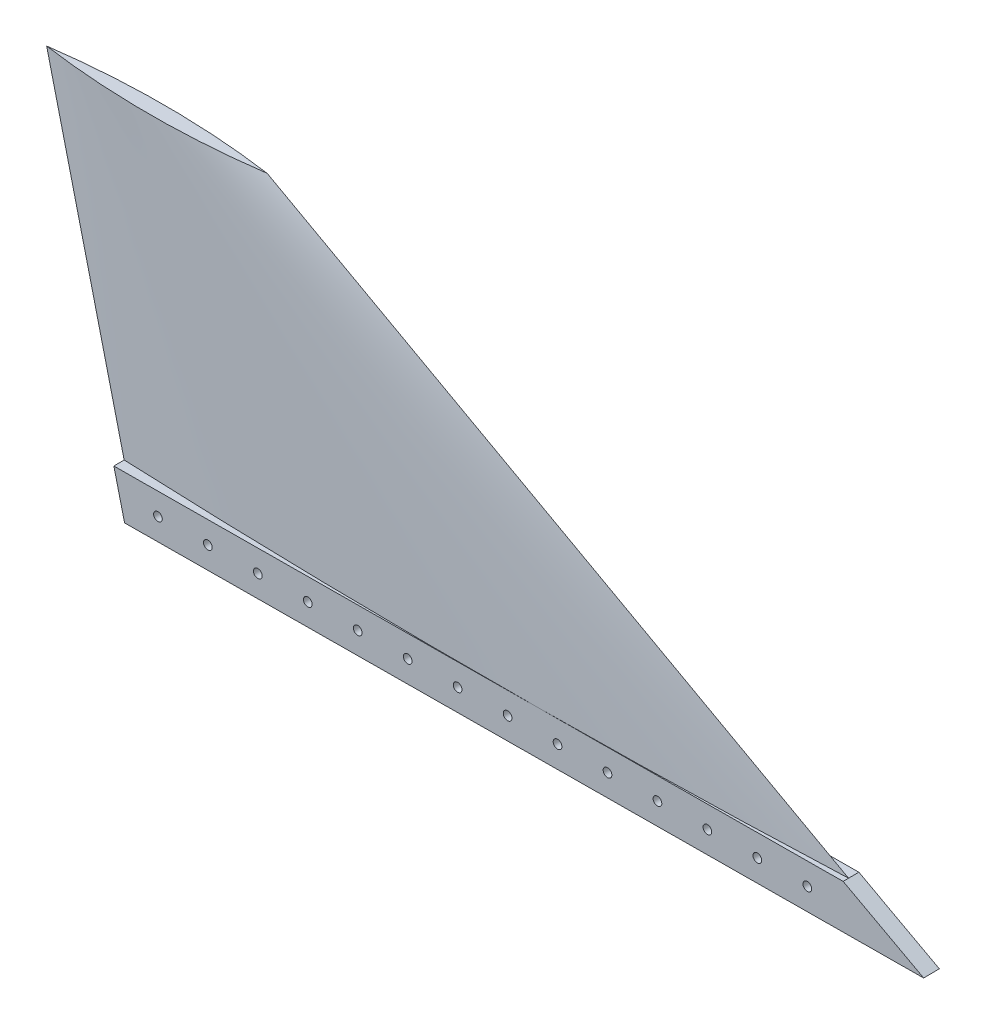
from build123d import *

# Parameters (mm, degrees)
BOSS_EXTRUDE1_DEPTH     = 9.116519994
CUT_EXTRUDE1_DEPTH      = 503.991265391
CUT_EXTRUDE1_DEPTH_BACK = 503.991265391
SKETCH12_W              = 6.35
SKETCH12_H              = 25.4
F_10_CLEARANCE_HOLE1_D  = 4.9784
LPATTERN1_START         = -3.180371244
LPATTERN1_OUTLINE_R     = 2.4892
LPATTERN1_DEPTH         = 9.116519994
SKETCH14_W              = 457.207880774
SKETCH14_H              = 25.4
CUT_EXTRUDE2_DEPTH      = 504.063817152


# Read off the part's stored shape, not the designer's step: LPattern1
with BuildPart() as part:
    # Sketch5 for Loft4 → Loft4 section 0
    with BuildSketch(Plane(origin=(0, 209.55, 0), x_dir=(1, 0, 0), z_dir=(0, 1, 0))):
        with BuildLine():
            # circular arc as an exact rational Bezier (weights 1, cos(half-angle), 1)
            Bezier((-50.8, 0), (12.7, 8.9337755), (76.2, 0), weights=[1, 0.990247786, 1])
            Bezier((76.2, 0), (12.7, -8.9337755), (-50.8, 0), weights=[1, 0.990247786, 1])
        make_face()
    # Sketch1 for Loft4 → Loft4 section 1
    with BuildSketch(Plane(origin=(0, 0, 0), x_dir=(1, 0, 0), z_dir=(0, 1, 0))):
        with BuildLine():
            Bezier((0, 0), (228.6, 8.89336246), (457.2, 0), weights=[1, 0.999244113, 1])
            Bezier((457.2, 0), (228.6, -8.89336246), (0, 0), weights=[1, 0.999244113, 1])
        make_face()
    loft()

    # Sketch10 → Boss-Extrude1 (add)
    with BuildSketch(Plane(origin=(-0.021647933, 0, -3.180297568), x_dir=(0, -1, 0), z_dir=(0.006806731520561807, 0, 0.9999768339346702))):
        Polygon((0, 457.189408475), (0, 0), (-25.4, -6.157433111), (-25.4, 411.008660144), align=None)
    extrude(amount=BOSS_EXTRUDE1_DEPTH)

    # Sketch12 → Cut-Extrude1 (cut, two sides: drawn at the far end of the back side and taken through both)
    with BuildSketch(Plane(origin=(0, 0, 0), x_dir=(0.006806731520561808, 0, 0.9999768339346703), z_dir=(-0.9999768339346703, 0, 0.006806731520561808)).offset(-CUT_EXTRUDE1_DEPTH_BACK)):
        with Locations((9.11114875, 12.7)):
            Rectangle(SKETCH12_W, SKETCH12_H)
        with Locations((-6.355371244, 12.7)):
            Rectangle(SKETCH12_W, SKETCH12_H)
    extrude(amount=CUT_EXTRUDE1_DEPTH + CUT_EXTRUDE1_DEPTH_BACK, mode=Mode.SUBTRACT)

    # #10 Clearance Hole1 (through all)
    with Locations(Plane(origin=(0.097036893, 0, 14.25568857), x_dir=(0, -1, 0), z_dir=(0.006806731520561807, 0, 0.9999768339346702))):
        with Locations((-12.7, 19.05)):
            Hole(F_10_CLEARANCE_HOLE1_D / 2)

    # LPattern1 outline → LPattern1 (cut)
    with BuildSketch(Plane(origin=(0, 0, 0), x_dir=(0.9999768339346702, 0, -0.006806731520561811), z_dir=(0.006806731520561811, 0, 0.9999768339346702)).offset(LPATTERN1_START)):
        with Locations((47.62433803, 12.7)):
            Circle(LPATTERN1_OUTLINE_R)
        with Locations((76.198676059, 12.7)):
            Circle(LPATTERN1_OUTLINE_R)
        with Locations((104.773014089, 12.7)):
            Circle(LPATTERN1_OUTLINE_R)
        with Locations((133.347352119, 12.7)):
            Circle(LPATTERN1_OUTLINE_R)
        with Locations((161.921690148, 12.7)):
            Circle(LPATTERN1_OUTLINE_R)
        with Locations((190.496028178, 12.7)):
            Circle(LPATTERN1_OUTLINE_R)
        with Locations((219.070366208, 12.7)):
            Circle(LPATTERN1_OUTLINE_R)
        with Locations((247.644704237, 12.7)):
            Circle(LPATTERN1_OUTLINE_R)
        with Locations((276.219042267, 12.7)):
            Circle(LPATTERN1_OUTLINE_R)
        with Locations((304.793380297, 12.7)):
            Circle(LPATTERN1_OUTLINE_R)
        with Locations((333.367718327, 12.7)):
            Circle(LPATTERN1_OUTLINE_R)
        with Locations((361.942056356, 12.7)):
            Circle(LPATTERN1_OUTLINE_R)
        with Locations((390.516394386, 12.7)):
            Circle(LPATTERN1_OUTLINE_R)
    extrude(amount=LPATTERN1_DEPTH, mode=Mode.SUBTRACT)

    # Sketch14 → Cut-Extrude2 (cut, through all)
    with BuildSketch(Plane(origin=(0.040405771, 0, 5.936011232), x_dir=(0.9999768339346702, 0, -0.006806731520561792), z_dir=(0.006806731520561792, 0, 0.9999768339346703))):
        with Locations((228.585468088, -12.6238)):
            Rectangle(SKETCH14_W, SKETCH14_H)
    extrude(amount=-CUT_EXTRUDE2_DEPTH, mode=Mode.SUBTRACT)


solid = part.part
